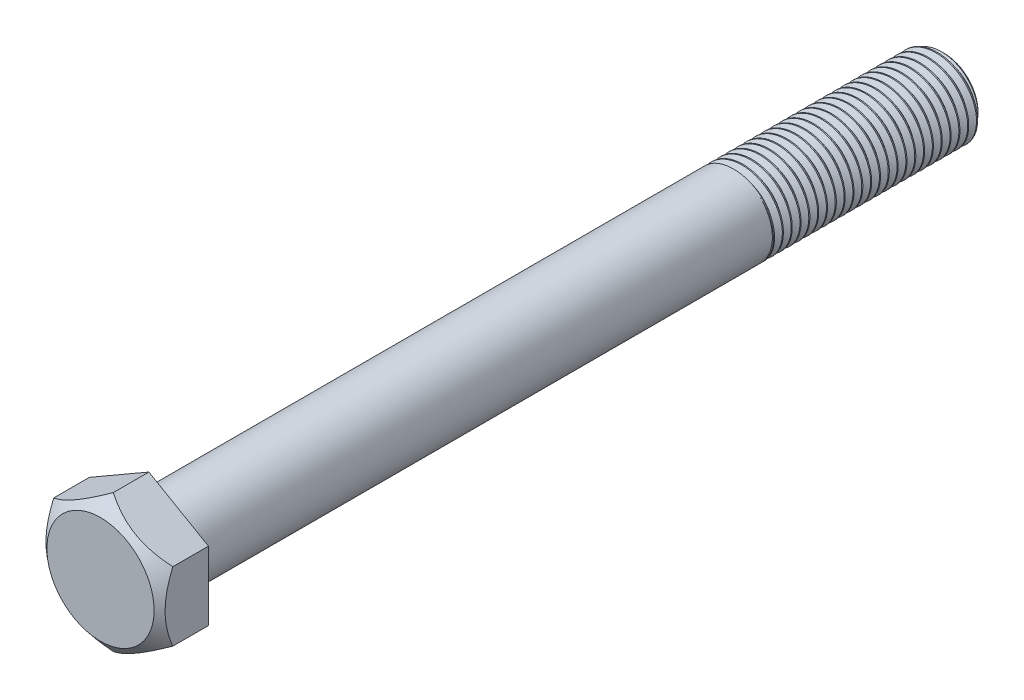
from build123d import *
from build123d.topology import SkipClean

# Parameters (mm, degrees)
BOSS_EXTRUDE1_DEPTH = 5.953125
SKETCH4_OUTSIDE_W   = 281.994
SKETCH4_OUTSIDE_H   = 284.204
SKETCH4_OUTSIDE_R   = 6.429375
CUT_EXTRUDE1_DEPTH  = 102.789733729
CUT_EXTRUDE1_DRAFT  = -50
SKETCH9_R           = 8.248891971
SKETCH9_R_2         = 6.7865625
CUT_EXTRUDE2_DEPTH  = 0.148828125
CUT_SWEEP1_PITCH    = 1.058333333
SKETCH8_W           = 1.058333333
SKETCH8_H           = 4.7625


# Read off the part's stored shape, not the designer's step: Split1
with BuildPart() as part:
    # Sketch2 → Revolve1 (revolve)
    with BuildSketch(Plane(origin=(0, 0, 0), x_dir=(0, 0, -1), z_dir=(1, 0, 0)), mode=Mode.PRIVATE) as revolve1_sk:
        Polygon((95.25, 0), (0, 0), (0, 4.7625), (94.509166667, 4.7625), (95.25, 4.021666667), align=None)
    revolve(revolve1_sk.sketch.rotate(Axis((0, 0, -95.25), (0, 0, 1)), 90), axis=Axis((0, 0, -95.25), (0, 0, 1)))

    # Sketch3 → Boss-Extrude1 (add)
    with BuildSketch(Plane.XY):
        Polygon((0, 8.248891971), (-7.14375, 4.124445986), (-7.14375, -4.124445986), (0, -8.248891971), (7.14375, -4.124445986), (7.14375, 4.124445986), align=None)
    extrude(amount=BOSS_EXTRUDE1_DEPTH)


with BuildPart() as cut_extrude1_tool:
    # Sketch4 outside → Cut-Extrude1 (with draft: the straight prism first)
    with BuildSketch(Plane.XY.offset(5.953125)):
        Rectangle(SKETCH4_OUTSIDE_W, SKETCH4_OUTSIDE_H)
        Circle(SKETCH4_OUTSIDE_R, mode=Mode.SUBTRACT)
    extrude(amount=-CUT_EXTRUDE1_DEPTH)
    # Cut-Extrude1: the draft: its side faces are tilted about the plane it starts from
    cut_extrude1_sides = [cut_extrude1_tool.faces().sort_by_distance(p)[0] for p in [
        (0, -142.102, -45.441741864),
        (140.997, 0, -45.441741864),
        (0, 142.102, -45.441741864),
        (-140.997, 0, -45.441741864),
        (-6.429375, 0, -45.441741864),
    ]]
    draft(cut_extrude1_sides, Plane.XY.offset(5.953125), CUT_EXTRUDE1_DRAFT)


with BuildPart() as part_1:
    add(part.part)

    # Cut-Extrude1: cut by cut_extrude1_tool
    add(cut_extrude1_tool.part, mode=Mode.SUBTRACT)

    # Sketch9 → Cut-Extrude2 (cut)
    with BuildSketch(Plane(origin=(0, 0, 0), x_dir=(-1, 0, 0), z_dir=(0, 0, -1))):
        Circle(SKETCH9_R)
        Circle(SKETCH9_R_2, mode=Mode.SUBTRACT)
    extrude(amount=-CUT_EXTRUDE2_DEPTH, mode=Mode.SUBTRACT)


with BuildPart() as body_2:
    # Split1: the piece on the far side of the plane
    add(part_1.part)
    split(bisect_by=Plane.XY, keep=Keep.BOTTOM)

    # Cut-Sweep1: the profile of Sketch6 screwed along a right-hand helix of 25 turns, 8 arcs to a turn; built about Z, then put on its axis
    cut_sweep1_z = Axis((0, 0, 0), (0, 0, 1))
    cut_sweep1_corners = [(4.819783972, 0, 0.033072917), (4.819783972, 0, -0.959114583), (4.075092336, 0, -0.529166667), (4.075092336, 0, -0.396875)]
    with BuildLine(mode=Mode.PRIVATE) as cut_sweep1_profile:
        Line(cut_sweep1_corners[0], cut_sweep1_corners[1])
        Line(cut_sweep1_corners[1], cut_sweep1_corners[2])
        Line(cut_sweep1_corners[2], cut_sweep1_corners[3])
        Line(cut_sweep1_corners[3], cut_sweep1_corners[0])
    cut_sweep1_cap = Face(cut_sweep1_profile.wire())
    cut_sweep1_turn_angles = [0, 22.5, 45, 67.5, 90, 112.5, 135, 157.5, 180, 202.5, 225, 247.5, 270, 292.5, 315, 337.5, 360]
    cut_sweep1_turn_weights = [1, 0.9238795325112867, 1, 0.9238795325112867, 1, 0.9238795325112867, 1, 0.9238795325112867, 1, 0.9238795325112867, 1, 0.9238795325112867, 1, 0.9238795325112867, 1, 0.9238795325112867, 1]
    cut_sweep1_turn_rails = [Edge.make_bspline([Vector(p[0], p[1], 0).rotate(cut_sweep1_z, cut_sweep1_turn_angles[k]) / cut_sweep1_turn_weights[k] + Vector(0, 0, p[2] + CUT_SWEEP1_PITCH * cut_sweep1_turn_angles[k] / 360) for k in range(17)], [0, 0, 0, 1, 1, 2, 2, 3, 3, 4, 4, 5, 5, 6, 6, 7, 7, 8, 8, 8], 2, cut_sweep1_turn_weights) for p in cut_sweep1_corners]
    cut_sweep1_turn_sides = [Face.make_surface_from_curves(cut_sweep1_turn_rails[p[0]], cut_sweep1_turn_rails[p[1]]) for p in [(0, 1), (1, 2), (2, 3), (3, 0)]]
    cut_sweep1 = Plane(origin=(0, 0, -95.25), x_dir=(0, 1, 0), z_dir=(0, 0, 1)) * Solid(Shell([*[p.moved(Location((0, 0, CUT_SWEEP1_PITCH * i))) for i in range(25) for p in cut_sweep1_turn_sides], cut_sweep1_cap, cut_sweep1_cap.rotate(cut_sweep1_z, 9000).moved(Location((0, 0, CUT_SWEEP1_PITCH * 9000 / 360)))]))
    add(cut_sweep1, mode=Mode.SUBTRACT)


with BuildPart() as part_2:
    add(part_1.part)

    # Split1
    split(bisect_by=Plane.XY, keep=Keep.TOP)

    # Combine1: union body 2
    add(body_2.part)

    # Sketch8 → Revolve2 (revolve)
    with SkipClean():  # the faces are left unmerged after this step: merging them gives an invalid solid
        with BuildSketch(Plane(origin=(0, 0, 0), x_dir=(0, 0, -1), z_dir=(1, 0, 0)), mode=Mode.PRIVATE) as revolve2_sk:
            with Locations((69.320833334, 2.38125)):
                Rectangle(SKETCH8_W, SKETCH8_H)
        revolve(revolve2_sk.sketch.rotate(Axis((0, 0, -68.791666667), (0, 0, -1)), 270), axis=Axis((0, 0, -68.791666667), (0, 0, -1)))


solid = part_2.part
